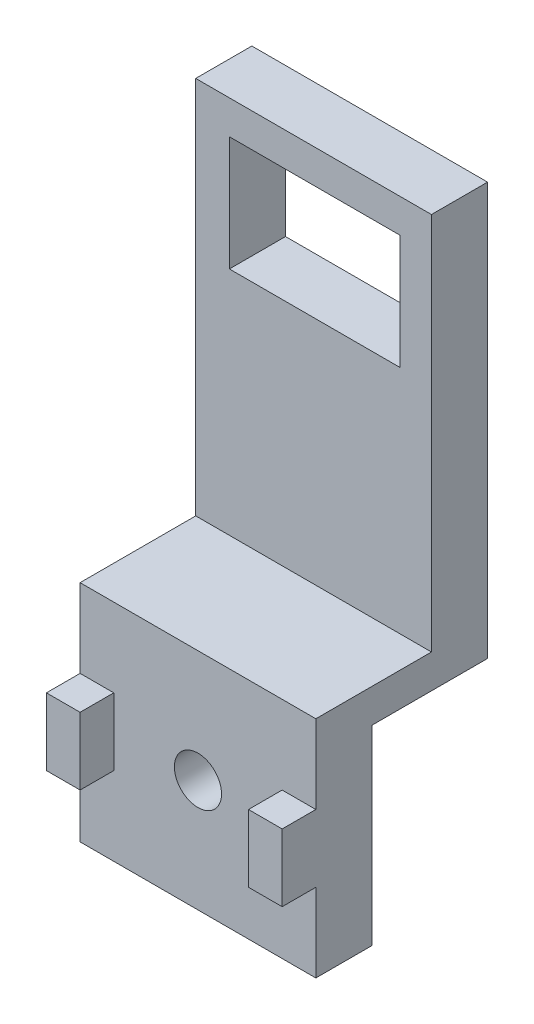
from build123d import *

# Parameters (mm, degrees)
SKETCH1_W           = 21
SKETCH1_H           = 53.75
SKETCH1_R           = 2.1
SKETCH1_W_2         = 15.2
SKETCH1_H_2         = 10.2
BOSS_EXTRUDE1_DEPTH = 15.3
SKETCH2_W           = 10.3
SKETCH2_H           = 33.75
SKETCH2_H_2         = 17
CUT_EXTRUDE1_DEPTH  = 21
SKETCH3_W           = 3
SKETCH3_H           = 6
BOSS_EXTRUDE2_DEPTH = 3


with BuildPart() as part:
    # Sketch1 → Boss-Extrude1 (new body)
    with BuildSketch(Plane.XY):
        with Locations((10.5, 26.875)):
            Rectangle(SKETCH1_W, SKETCH1_H)
        with Locations((10.5, 10)):
            Circle(SKETCH1_R, mode=Mode.SUBTRACT)
        with Locations((10.6, 45.65)):
            Rectangle(SKETCH1_W_2, SKETCH1_H_2, mode=Mode.SUBTRACT)
    extrude(amount=BOSS_EXTRUDE1_DEPTH)

    # Sketch2 → Cut-Extrude1 (cut)
    with BuildSketch(Plane.ZY):
        with Locations((10.15, 36.875)):
            Rectangle(SKETCH2_W, SKETCH2_H)
        with Locations((5.15, 8.5)):
            Rectangle(SKETCH2_W, SKETCH2_H_2)
    extrude(amount=-CUT_EXTRUDE1_DEPTH, mode=Mode.SUBTRACT)

    # Sketch3 → Boss-Extrude2 (add)
    with BuildSketch(Plane.XY.offset(15.3)):
        with Locations((1.5, 10)):
            Rectangle(SKETCH3_W, SKETCH3_H)
        with Locations((19.5, 10)):
            Rectangle(SKETCH3_W, SKETCH3_H)
    extrude(amount=BOSS_EXTRUDE2_DEPTH)


solid = part.part
